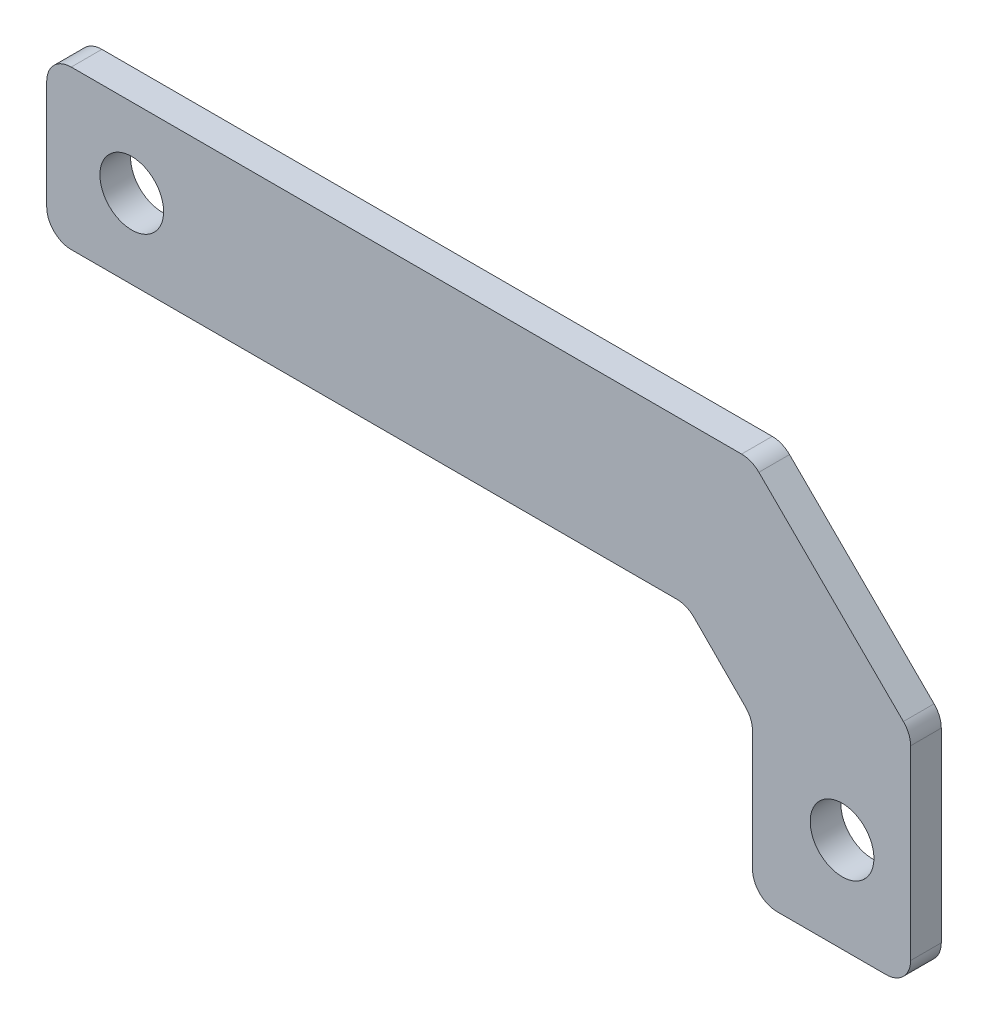
from build123d import *

# Parameters (mm, degrees)
BASE_FLANGE1_DEPTH   = 3.175
M6_CLEARANCE_HOLE1_D = 6.6
FILLET1_R            = 2.54


# Sheet-metal steps are written as plain solids
with BuildPart() as part:
    # Sketch1 → Base-Flange1 (new body)
    with BuildSketch(Plane.XY):
        Polygon((63.66772505, -78.480441727), (47.205847983, -62.123600001), (-25.819152017, -62.123600001), (-25.819152017, -78.501600001), (40.496105752, -78.501600001), (47.28972505, -85.338441727), (47.28972505, -101.340441727), (63.66772505, -101.340441727), align=None)
    extrude(amount=-BASE_FLANGE1_DEPTH)

    # M6 Clearance Hole1 (through all)
    with Locations(Plane.XY):
        with Locations((56.565919048, -91.535610498), (-17.0119, -70.312600001)):
            Hole(M6_CLEARANCE_HOLE1_D / 2)

    # Fillet1
    fillet1_edges = [part.edges().sort_by_distance(p)[0] for p in [
        (-25.819152017, -62.123600001, -1.5875),
        (47.205847983, -62.123600001, -1.5875),
        (63.66772505, -78.480441727, -1.5875),
        (63.66772505, -101.340441727, -1.5875),
        (47.28972505, -101.340441727, -1.5875),
        (47.28972505, -85.338441727, -1.5875),
        (40.496105752, -78.501600001, -1.5875),
        (-25.819152017, -78.501600001, -1.5875),
    ]]
    fillet(fillet1_edges, radius=FILLET1_R)


solid = part.part
